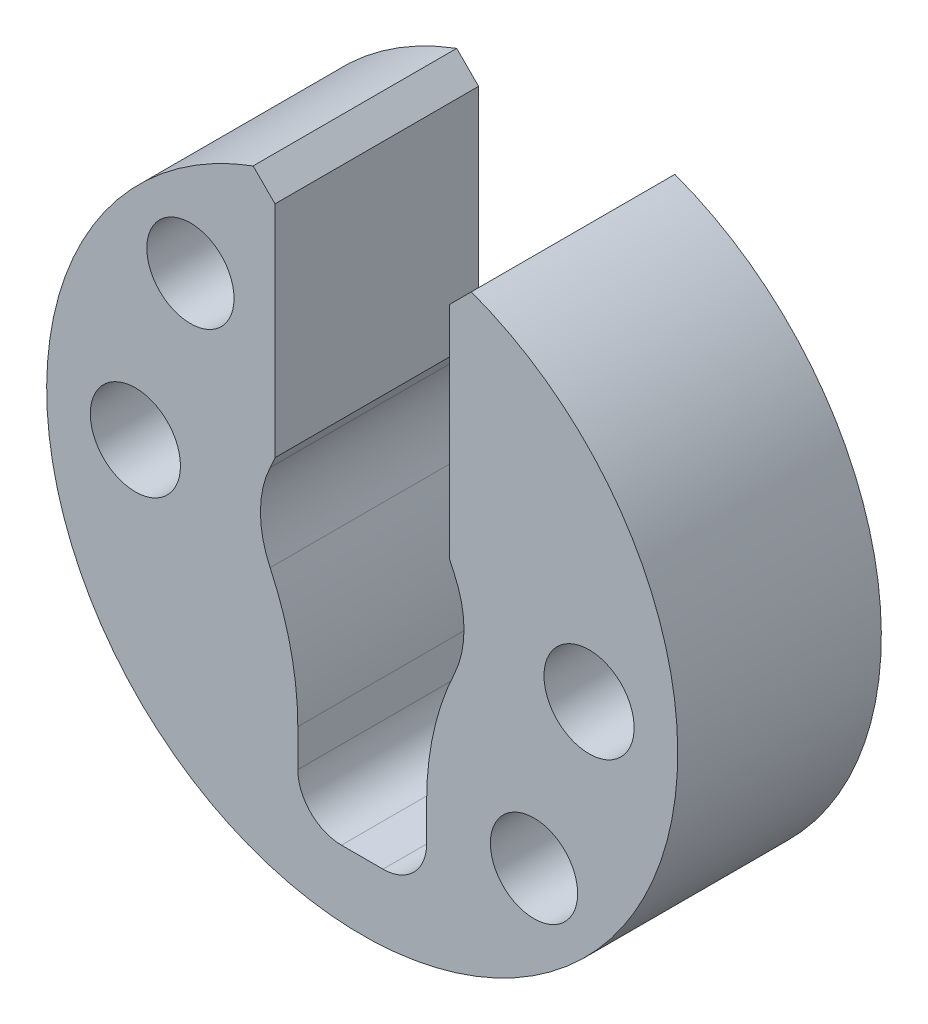
from build123d import *

# Parameters (mm, degrees)
SKETCH1_R           = 10.85
SKETCH1_R_2         = 1.55
BOSS_EXTRUDE1_DEPTH = 7
CUT_EXTRUDE1_DEPTH  = 10
SKETCH3_R           = 1.55
BOSS_EXTRUDE2_DEPTH = 2.5
SKETCH6_W           = 5.995922228
SKETCH6_H           = 11.403727684
CUT_EXTRUDE3_DEPTH  = 11.5
CHAMFER2_SIZE       = 1
SKETCH7_R           = 1.5
CUT_EXTRUDE4_DEPTH  = 11.5
CHAMFER3_SIZE       = 0.5


with BuildPart() as part:
    # Sketch1 → Boss-Extrude1 (new body)
    with BuildSketch(Plane.XY):
        Circle(SKETCH1_R)
        with Locations((-7.8, 0)):
            Circle(SKETCH1_R_2, mode=Mode.SUBTRACT)
        with Locations(Location((7.8, 0, 0), (0, 0, 180))):
            Circle(SKETCH1_R_2, mode=Mode.SUBTRACT)
    extrude(amount=BOSS_EXTRUDE1_DEPTH)

    # Sketch2 → Cut-Extrude1 (cut)
    with BuildSketch(Plane.XY.offset(7)):
        with BuildLine():
            Line((-2.214560219, -5.749305929), (-2.214560219, -7.027203312))
            ThreePointArc((-2.214560219, -7.027203312), (-1.775220391, -8.087863484), (-0.714560219, -8.527203312))
            Line((-0.714560219, -8.527203312), (0.714560219, -8.527203312))
            ThreePointArc((0.714560219, -8.527203312), (1.775220391, -8.087863484), (2.214560219, -7.027203312))
            Line((2.214560219, -7.027203312), (2.214560219, -5.749305929))
            ThreePointArc((2.214560219, -5.749305929), (2.4555074, -3.56735999), (3.166737835, -1.490560796))
            ThreePointArc((3.166737835, -1.490560796), (3.5, 0), (3.166737835, 1.490560796))
            ThreePointArc((3.166737835, 1.490560796), (2.4555074, 3.56735999), (2.214560219, 5.749305929))
            Line((2.214560219, 5.749305929), (2.214560219, 8.304826852))
            ThreePointArc((2.214560219, 8.304826852), (1.775220391, 9.365487023), (0.714560219, 9.804826852))
            Line((0.714560219, 9.804826852), (-0.714560219, 9.804826852))
            ThreePointArc((-0.714560219, 9.804826852), (-1.775220391, 9.365487023), (-2.214560219, 8.304826852))
            Line((-2.214560219, 8.304826852), (-2.214560219, 5.749305929))
            ThreePointArc((-2.214560219, 5.749305929), (-2.4555074, 3.56735999), (-3.166737835, 1.490560796))
            ThreePointArc((-3.166737835, 1.490560796), (-3.5, 0), (-3.166737835, -1.490560796))
            ThreePointArc((-3.166737835, -1.490560796), (-2.4555074, -3.56735999), (-2.214560219, -5.749305929))
        make_face()
    extrude(amount=-CUT_EXTRUDE1_DEPTH, mode=Mode.SUBTRACT)

    # Sketch3 → Boss-Extrude2 (add)
    with BuildSketch(Plane(origin=(0, 0, 0), x_dir=(-1, 0, 0), z_dir=(0, 0, -1))):
        with Locations((-7.8, 0)):
            Circle(SKETCH3_R)
        with Locations((7.8, 0)):
            Circle(SKETCH3_R)
    extrude(amount=-BOSS_EXTRUDE2_DEPTH)

    # Sketch6 → Cut-Extrude3 (cut)
    with BuildSketch(Plane.XY.offset(7)):
        with Locations((0, 5.701863842)):
            Rectangle(SKETCH6_W, SKETCH6_H)
    extrude(amount=-CUT_EXTRUDE3_DEPTH, mode=Mode.SUBTRACT)

    # Chamfer2
    # the kernel refuses this chamfer: 1, 0.808160216 mm, written as the material it takes off along each edge
    with BuildSketch(Plane(origin=(-2.997961114, 10.427594601, 9.571682988), x_dir=(-0.9503340771083855, -0.3112316530922798, 0), z_dir=(0, 0, -1))) as chamfer2_piece_1:
        with BuildLine():
            Line((0.792665793, 0), (CHAMFER2_SIZE * 0.311231653092, -CHAMFER2_SIZE * 0.950334077108))
            Line((CHAMFER2_SIZE * 0.311231653092, -CHAMFER2_SIZE * 0.950334077108), (0, 0))
            ThreePointArc((0, 0), (0.405362345, 0.007237358), (0.792665793, 0))
        make_face()
    extrude(amount=12.143365976, mode=Mode.SUBTRACT)
    with BuildSketch(Plane(origin=(2.997961114, 10.427594601, 9.571682988), x_dir=(0.950334077108385, -0.31123165309228096, 0), z_dir=(0, 0, -1))) as chamfer2_piece_2:
        with BuildLine():
            Line((0.792665793, 0), (CHAMFER2_SIZE * 0.311231653092, CHAMFER2_SIZE * 0.950334077108))
            Line((CHAMFER2_SIZE * 0.311231653092, CHAMFER2_SIZE * 0.950334077108), (0, 0))
            ThreePointArc((0, 0), (0.405362345, -0.007237358), (0.792665793, 0))
        make_face()
    extrude(amount=12.143365976, mode=Mode.SUBTRACT)

    # Sketch7 → Cut-Extrude4 (cut)
    with BuildSketch(Plane.XY.offset(7)):
        with Locations((-5.907204398, 5.907204398)):
            Circle(SKETCH7_R)
        with Locations((5.907204398, -5.907204398)):
            Circle(SKETCH7_R)
    extrude(amount=-CUT_EXTRUDE4_DEPTH, mode=Mode.SUBTRACT)

    # Chamfer3
    chamfer3_edges = [part.edges().sort_by_distance(p)[0] for p in [
        (-7.407204398, 5.907204398, 0),
        (4.407204398, -5.907204398, 0),
    ]]
    chamfer(chamfer3_edges, length=CHAMFER3_SIZE)


solid = part.part
